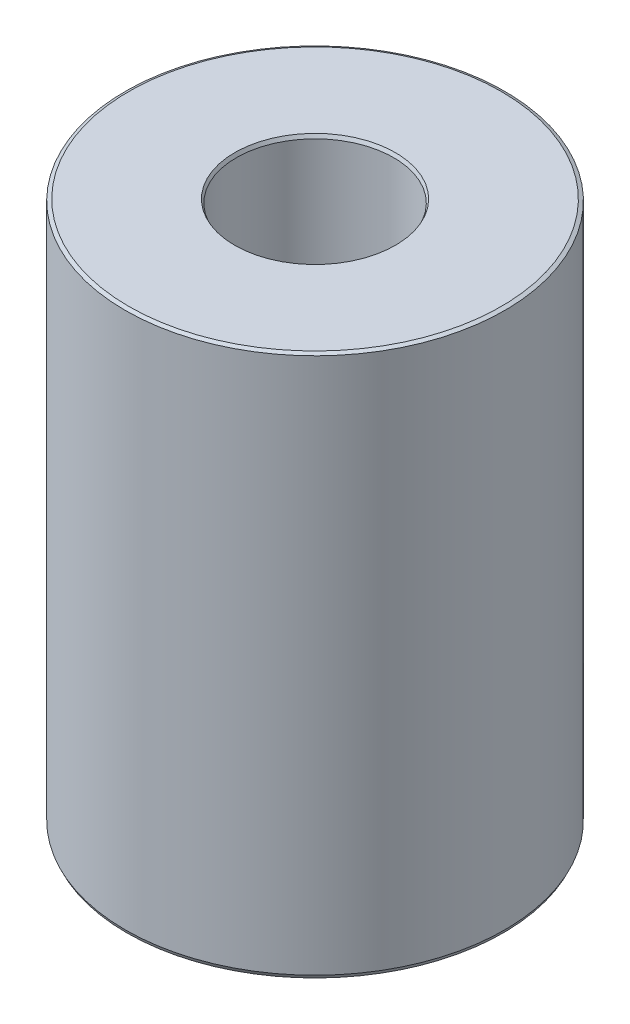
from build123d import *
from OCP.BRepFilletAPI import BRepFilletAPI_MakeChamfer

# Parameters (mm, degrees)
SKETCH1_R           = 32.5
BOSS_EXTRUDE1_DEPTH = 92.768973788
SKETCH2_R           = 13.476569149
CUT_EXTRUDE1_DEPTH  = 104.530587256
CHAMFER1_SIZE       = 0.285099224
CHAMFER1_SIZE2      = 0.609343688


with BuildPart() as part:
    # Sketch1 → Boss-Extrude1 (new body)
    with BuildSketch(Plane(origin=(0, 0, 0), x_dir=(1, 0, 0), z_dir=(0, 1, 0))):
        Circle(SKETCH1_R)
    extrude(amount=BOSS_EXTRUDE1_DEPTH)

    # Sketch2 → Cut-Extrude1 (cut, through all)
    with BuildSketch(Plane(origin=(0, 0, 0), x_dir=(1, 0, 0), z_dir=(0, 1, 0))):
        Circle(SKETCH2_R)
    extrude(amount=CUT_EXTRUDE1_DEPTH, mode=Mode.SUBTRACT)

    # Chamfer1: one chamfer whose edges measure the first distance from different faces: ONE call of the kernel's chamfer builder (chamfer() names one face for all edges)
    chamfer1_edges_1 = [part.edges().sort_by_distance(p)[0] for p in [
        (-13.476569149, 92.768973788, 0),
    ]]
    chamfer1_side_1 = [part.faces().sort_by_distance(p)[0] for p in [
        (-31.580761184, 92.768973788, 0),
    ]]
    chamfer1_edges_2 = [part.edges().sort_by_distance(p)[0] for p in [
        (-13.476569149, 0, 0),
    ]]
    chamfer1_side_2 = [part.faces().sort_by_distance(p)[0] for p in [
        (-13.476569149, 46.384486894, 0),
    ]]
    chamfer1_edges_3 = [part.edges().sort_by_distance(p)[0] for p in [
        (-32.5, 0, 0),
    ]]
    chamfer1_side_3 = [part.faces().sort_by_distance(p)[0] for p in [
        (-31.580761184, 0, 0),
    ]]
    chamfer1_edges_4 = [part.edges().sort_by_distance(p)[0] for p in [
        (-32.5, 92.768973788, 0),
    ]]
    chamfer1_side_4 = [part.faces().sort_by_distance(p)[0] for p in [
        (-32.5, 46.384486894, 0),
    ]]
    chamfer1 = BRepFilletAPI_MakeChamfer(part.part.solid().wrapped)
    for e in chamfer1_edges_1:
        chamfer1.Add(CHAMFER1_SIZE, CHAMFER1_SIZE2, e.wrapped, chamfer1_side_1[0].wrapped)  # the first distance lies on this face
    for e in chamfer1_edges_2:
        chamfer1.Add(CHAMFER1_SIZE, CHAMFER1_SIZE2, e.wrapped, chamfer1_side_2[0].wrapped)  # the first distance lies on this face
    for e in chamfer1_edges_3:
        chamfer1.Add(CHAMFER1_SIZE, CHAMFER1_SIZE2, e.wrapped, chamfer1_side_3[0].wrapped)  # the first distance lies on this face
    for e in chamfer1_edges_4:
        chamfer1.Add(CHAMFER1_SIZE, CHAMFER1_SIZE2, e.wrapped, chamfer1_side_4[0].wrapped)  # the first distance lies on this face
    add(Compound.cast(chamfer1.Shape()), mode=Mode.REPLACE)


solid = part.part
